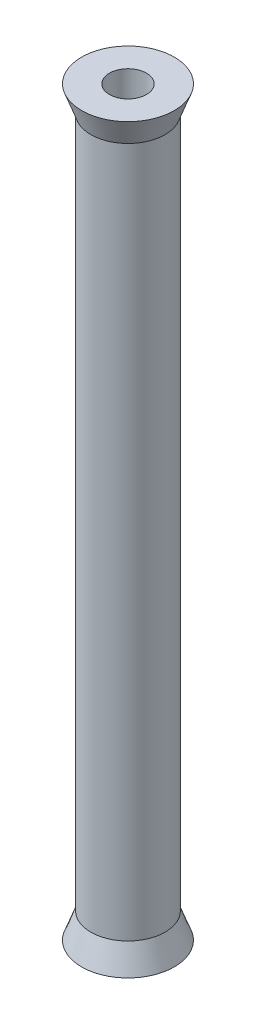
from build123d import *


with BuildPart() as part:
    # Sketch1 → Revolve1 (revolve)
    with BuildSketch(Plane.XY):
        Polygon((2, -40), (5, -40), (4, -37.252522581), (4, 37.252522581), (5, 40), (2, 40), align=None)
    revolve(axis=Axis((0, 0, 0), (0, -1, 0)))


solid = part.part
